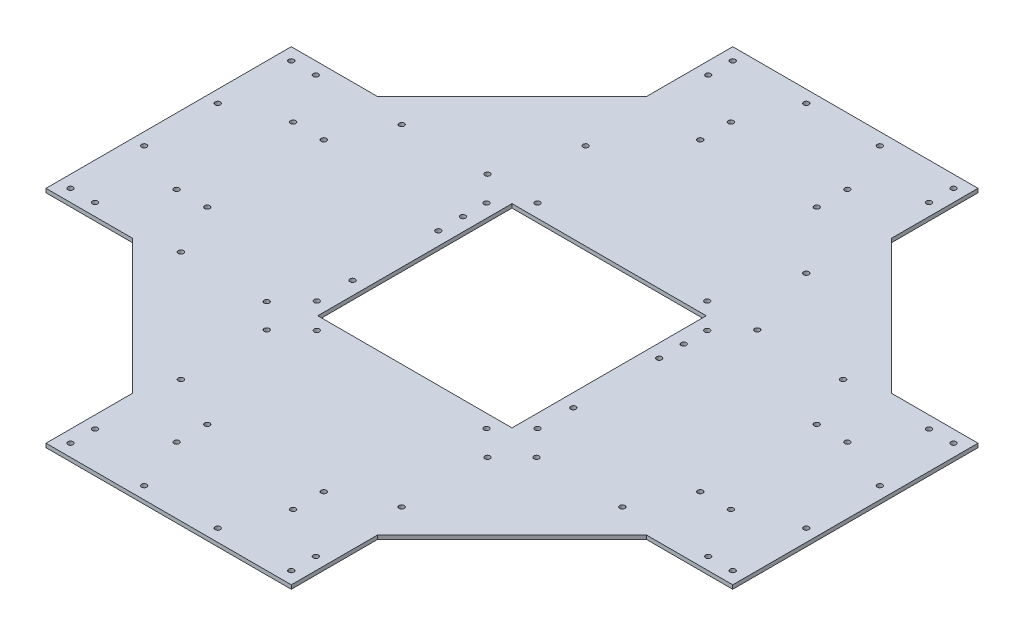
from build123d import *

# Parameters (mm, degrees)
SKETCH1_R           = 2.125
BOSS_EXTRUDE1_DEPTH = 3.175
SKETCH2_R           = 2.125
SKETCH2_W           = 158.4
SKETCH2_H           = 158.4
CUT_EXTRUDE1_DEPTH  = 396.992525971


with BuildPart() as part:
    # Sketch1 → Boss-Extrude1 (new body)
    with BuildSketch(Plane(origin=(0, 0, 0), x_dir=(1, 0, 0), z_dir=(0, 1, 0))):
        Polygon((-100, -280), (0, -280), (100, -280), (100, -209.601551084), (209.601551084, -100), (280, -100), (280, 0), (280, 100), (209.601551084, 100), (100, 209.601551084), (100, 280), (0, 280), (-100, 280), (-100, 209.601551084), (-209.601551084, 100), (-280, 100), (-280, 0), (-280, -100), (-209.601551084, -100), (-100, -209.601551084), align=None)
        with Locations((-90, -270)):
            Circle(SKETCH1_R, mode=Mode.SUBTRACT)
        with Locations((-90, -250)):
            Circle(SKETCH1_R, mode=Mode.SUBTRACT)
        with Locations((-30, -270)):
            Circle(SKETCH1_R, mode=Mode.SUBTRACT)
        with Locations((-47.5, -226)):
            Circle(SKETCH1_R, mode=Mode.SUBTRACT)
        with Locations((-90, -180)):
            Circle(SKETCH1_R, mode=Mode.SUBTRACT)
        with Locations((-47.5, -201)):
            Circle(SKETCH1_R, mode=Mode.SUBTRACT)
        with Locations((-270, -90)):
            Circle(SKETCH1_R, mode=Mode.SUBTRACT)
        with Locations((-250, -90)):
            Circle(SKETCH1_R, mode=Mode.SUBTRACT)
        with Locations((-180, -90)):
            Circle(SKETCH1_R, mode=Mode.SUBTRACT)
        with Locations((-226, -47.5)):
            Circle(SKETCH1_R, mode=Mode.SUBTRACT)
        with Locations((-270, -30)):
            Circle(SKETCH1_R, mode=Mode.SUBTRACT)
        with Locations((-201, -47.5)):
            Circle(SKETCH1_R, mode=Mode.SUBTRACT)
        with Locations((-90, -110)):
            Circle(SKETCH1_R, mode=Mode.SUBTRACT)
        with Locations((-110, -90)):
            Circle(SKETCH1_R, mode=Mode.SUBTRACT)
        with Locations((-90, -40)):
            Circle(SKETCH1_R, mode=Mode.SUBTRACT)
        with Locations((30, -270)):
            Circle(SKETCH1_R, mode=Mode.SUBTRACT)
        with Locations((47.5, -226)):
            Circle(SKETCH1_R, mode=Mode.SUBTRACT)
        with Locations((90, -270)):
            Circle(SKETCH1_R, mode=Mode.SUBTRACT)
        with Locations((90, -250)):
            Circle(SKETCH1_R, mode=Mode.SUBTRACT)
        with Locations((47.5, -201)):
            Circle(SKETCH1_R, mode=Mode.SUBTRACT)
        with Locations((90, -180)):
            Circle(SKETCH1_R, mode=Mode.SUBTRACT)
        with Locations((90, -110)):
            Circle(SKETCH1_R, mode=Mode.SUBTRACT)
        with Locations((110, -90)):
            Circle(SKETCH1_R, mode=Mode.SUBTRACT)
        with Locations((90, -40)):
            Circle(SKETCH1_R, mode=Mode.SUBTRACT)
        with Locations((180, -90)):
            Circle(SKETCH1_R, mode=Mode.SUBTRACT)
        with Locations((250, -90)):
            Circle(SKETCH1_R, mode=Mode.SUBTRACT)
        with Locations((270, -90)):
            Circle(SKETCH1_R, mode=Mode.SUBTRACT)
        with Locations((201, -47.5)):
            Circle(SKETCH1_R, mode=Mode.SUBTRACT)
        with Locations((226, -47.5)):
            Circle(SKETCH1_R, mode=Mode.SUBTRACT)
        with Locations((270, -30)):
            Circle(SKETCH1_R, mode=Mode.SUBTRACT)
        with Locations((-270, 30)):
            Circle(SKETCH1_R, mode=Mode.SUBTRACT)
        with Locations((-226, 47.5)):
            Circle(SKETCH1_R, mode=Mode.SUBTRACT)
        with Locations((-201, 47.5)):
            Circle(SKETCH1_R, mode=Mode.SUBTRACT)
        with Locations((-270, 90)):
            Circle(SKETCH1_R, mode=Mode.SUBTRACT)
        with Locations((-250, 90)):
            Circle(SKETCH1_R, mode=Mode.SUBTRACT)
        with Locations((-180, 90)):
            Circle(SKETCH1_R, mode=Mode.SUBTRACT)
        with Locations((-90, 30)):
            Circle(SKETCH1_R, mode=Mode.SUBTRACT)
        with Locations((-90, 50)):
            Circle(SKETCH1_R, mode=Mode.SUBTRACT)
        with Locations((-110, 90)):
            Circle(SKETCH1_R, mode=Mode.SUBTRACT)
        with Locations((-90, 150)):
            Circle(SKETCH1_R, mode=Mode.SUBTRACT)
        with Locations((-47.5, 201)):
            Circle(SKETCH1_R, mode=Mode.SUBTRACT)
        with Locations((-90, 250)):
            Circle(SKETCH1_R, mode=Mode.SUBTRACT)
        with Locations((-90, 270)):
            Circle(SKETCH1_R, mode=Mode.SUBTRACT)
        with Locations((-47.5, 226)):
            Circle(SKETCH1_R, mode=Mode.SUBTRACT)
        with Locations((-30, 270)):
            Circle(SKETCH1_R, mode=Mode.SUBTRACT)
        with Locations((90, 30)):
            Circle(SKETCH1_R, mode=Mode.SUBTRACT)
        with Locations((90, 50)):
            Circle(SKETCH1_R, mode=Mode.SUBTRACT)
        with Locations((110, 90)):
            Circle(SKETCH1_R, mode=Mode.SUBTRACT)
        with Locations((201, 47.5)):
            Circle(SKETCH1_R, mode=Mode.SUBTRACT)
        with Locations((270, 30)):
            Circle(SKETCH1_R, mode=Mode.SUBTRACT)
        with Locations((226, 47.5)):
            Circle(SKETCH1_R, mode=Mode.SUBTRACT)
        with Locations((180, 90)):
            Circle(SKETCH1_R, mode=Mode.SUBTRACT)
        with Locations((250, 90)):
            Circle(SKETCH1_R, mode=Mode.SUBTRACT)
        with Locations((270, 90)):
            Circle(SKETCH1_R, mode=Mode.SUBTRACT)
        with Locations((47.5, 201)):
            Circle(SKETCH1_R, mode=Mode.SUBTRACT)
        with Locations((90, 150)):
            Circle(SKETCH1_R, mode=Mode.SUBTRACT)
        with Locations((47.5, 226)):
            Circle(SKETCH1_R, mode=Mode.SUBTRACT)
        with Locations((30, 270)):
            Circle(SKETCH1_R, mode=Mode.SUBTRACT)
        with Locations((90, 250)):
            Circle(SKETCH1_R, mode=Mode.SUBTRACT)
        with Locations((90, 270)):
            Circle(SKETCH1_R, mode=Mode.SUBTRACT)
    extrude(amount=BOSS_EXTRUDE1_DEPTH)

    # Sketch2 → Cut-Extrude1 (cut, through all)
    with BuildSketch(Plane(origin=(0, 3.175, 0), x_dir=(1, 0, 0), z_dir=(0, 1, 0))):
        with Locations((-90, 69.2)):
            Circle(SKETCH2_R)
        with Locations((-90, -69.2)):
            Circle(SKETCH2_R)
        with Locations((90, -69.2)):
            Circle(SKETCH2_R)
        with Locations((90, 69.2)):
            Circle(SKETCH2_R)
        with Locations((-69.2, 90)):
            Circle(SKETCH2_R)
        with Locations((69.2, 90)):
            Circle(SKETCH2_R)
        with Locations((69.2, -90)):
            Circle(SKETCH2_R)
        with Locations((-69.2, -90)):
            Circle(SKETCH2_R)
        Rectangle(SKETCH2_W, SKETCH2_H)
    extrude(amount=-CUT_EXTRUDE1_DEPTH, mode=Mode.SUBTRACT)


solid = part.part
